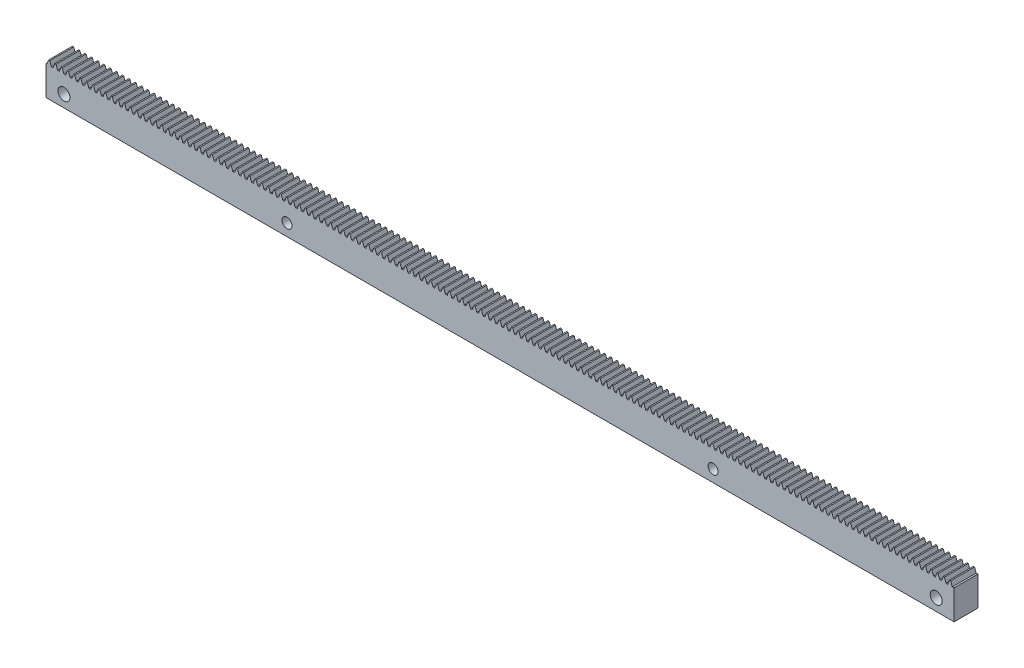
from build123d import *

# Parameters (mm, degrees)
BLANKSKE_W         = 228
BLANKSKE_H         = 8.5
BLANK_DEPTH        = 6
TOOTHCUTSIM_DEPTH  = 229.237266896
TEETHCUTS_COUNT    = 146
TEETHCUTS_PITCH    = 1.570796325
SKETCH1_R          = 1.5
SKETCH1_R_2        = 1.25
CUT_EXTRUDE1_DEPTH = 10


with BuildPart() as part:
    # BlankSke → Blank (new body)
    with BuildSketch(Plane.XY):
        with Locations((114, 4.25)):
            Rectangle(BLANKSKE_W, BLANKSKE_H)
    extrude(amount=-BLANK_DEPTH)

    # TooCutSkeSim → ToothCutSim (cut, through all)
    with BuildSketch(Plane.XY):
        Polygon((0.222217685, 7.375), (-0.222217685, 7.375), (-0.640929042, 8.5254), (0.640929042, 8.5254), align=None)
    toothcutsim = extrude(amount=-TOOTHCUTSIM_DEPTH, mode=Mode.SUBTRACT)

    # TeethCuts: ToothCutSim ×146
    with Locations(*[(i * TEETHCUTS_PITCH, 0, 0) for i in range(1, TEETHCUTS_COUNT)]):
        add(toothcutsim, mode=Mode.SUBTRACT)

    # Sketch1 → Cut-Extrude1 (cut)
    with BuildSketch(Plane.XY):
        with Locations((223.5, 3)):
            Circle(SKETCH1_R)
        with Locations(Location((4.5, 3, 0), (0, 0, 180))):
            Circle(SKETCH1_R)
        with Locations((60.515700098, 3)):
            Circle(SKETCH1_R_2)
        with Locations(Location((167.484299902, 3, 0), (0, 0, 180))):
            Circle(SKETCH1_R_2)
    extrude(amount=-CUT_EXTRUDE1_DEPTH, mode=Mode.SUBTRACT)


solid = part.part
